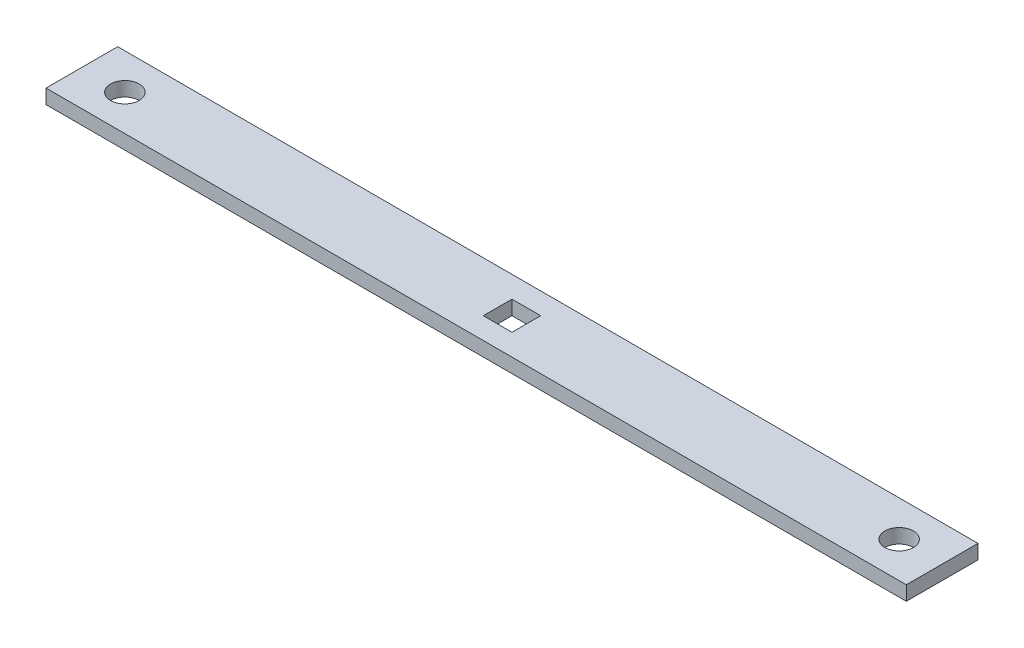
from build123d import *

# Parameters (mm, degrees)
SKETCH2_W               = 30
SKETCH2_H               = 2.5
BOSS_EXTRUDE1_DEPTH     = 0.5
CUT_EXTRUDE1_DEPTH      = 16.060295482
CUT_EXTRUDE1_DEPTH_BACK = 16.060295482
SKETCH3_R               = 0.5
SKETCH3_W               = 1
SKETCH3_H               = 1
SCALE1_SCALE            = 6


with BuildPart() as part:
    # Sketch2 → Boss-Extrude1 (new body)
    with BuildSketch(Plane(origin=(0, 0, 0), x_dir=(1, 0, 0), z_dir=(0, 1, 0))):
        Rectangle(SKETCH2_W, SKETCH2_H)
    extrude(amount=BOSS_EXTRUDE1_DEPTH)

    # Sketch3 → Cut-Extrude1 (cut, two sides: drawn at the far end of the back side and taken through both)
    with BuildSketch(Plane(origin=(0, 0.5, 0), x_dir=(1, 0, 0), z_dir=(0, 1, 0)).offset(-CUT_EXTRUDE1_DEPTH_BACK)):
        with Locations((-13.5, 0)):
            Circle(SKETCH3_R)
        with Locations((13.5, 0)):
            Circle(SKETCH3_R)
        Rectangle(SKETCH3_W, SKETCH3_H)
    extrude(amount=CUT_EXTRUDE1_DEPTH + CUT_EXTRUDE1_DEPTH_BACK, mode=Mode.SUBTRACT)


with BuildPart() as part_1:
    # Scale1: scaled about (0, 0.25, 0)
    add(part.part.scale(SCALE1_SCALE).moved(Location((0, -1.25, 0))))


solid = part_1.part
